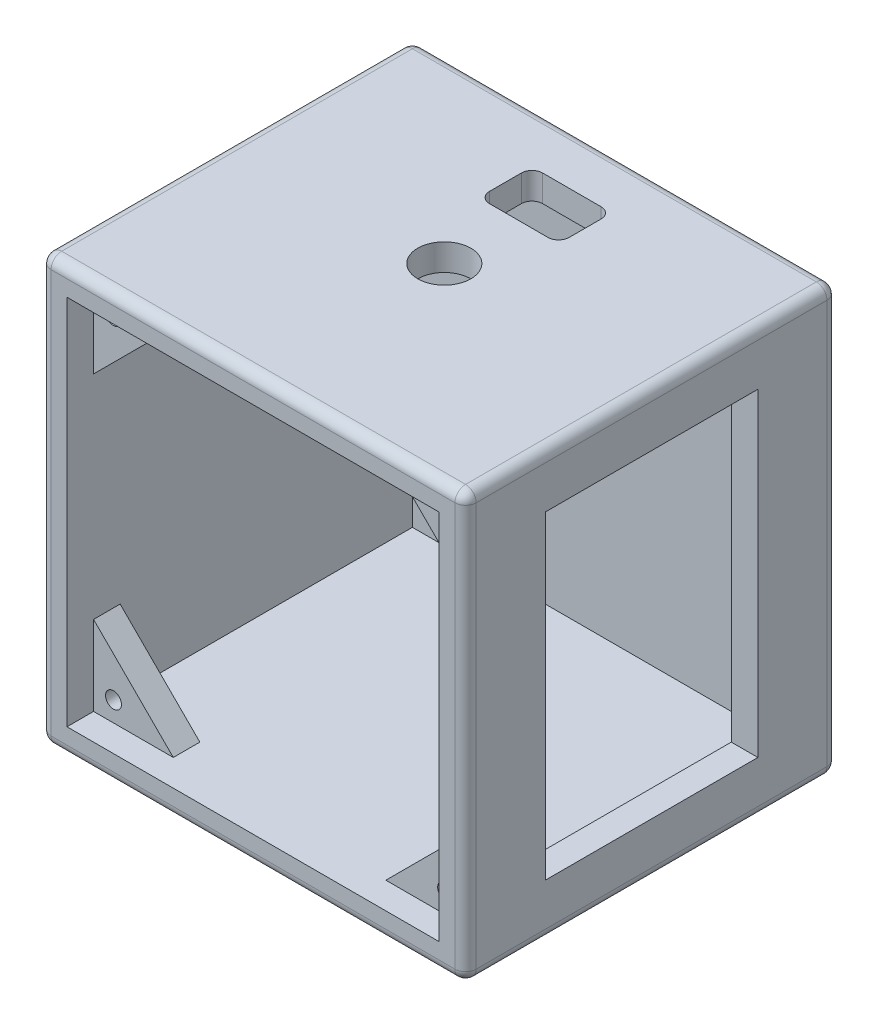
from build123d import *

# Parameters (mm, degrees)
SKETCH_1_W          = 80
SKETCH_1_H          = 80
EXTRUDE_1_DEPTH     = 70
SKETCH_2_W          = 70
SKETCH_2_H          = 70
CUT_EXTRUDE_1_DEPTH = 65
FILLET_1_R          = 2
FILLET_2_R          = 2
FILLET_3_R          = 2
CUT_EXTRUDE_3_DEPTH = 10
SKETCH_4_W          = 10
SKETCH_4_H          = 30
CUT_EXTRUDE_4_DEPTH = 10
SKETCH_5_R          = 5
CUT_EXTRUDE_5_DEPTH = 10
FILLET_4_R          = 2
SKETCH_6_W          = 40
SKETCH_6_H          = 60
CUT_EXTRUDE_6_DEPTH = 10
SKETCH_7_R          = 1.5
EXTRUDE_2_DEPTH     = 60
SKETCH_8_W          = 70
SKETCH_8_H          = 70
CUT_EXTRUDE_7_DEPTH = 60
SKETCH_9_W          = 70
SKETCH_9_H          = 70
EXTRUDE_3_DEPTH     = 5


with BuildPart() as part:
    # Эскиз1 → Бобышка-Вытянуть1 (new body)
    with BuildSketch(Plane.XY):
        Rectangle(SKETCH_1_W, SKETCH_1_H)
    extrude(amount=EXTRUDE_1_DEPTH)

    # Эскиз2 → Вырез-Вытянуть1 (cut)
    with BuildSketch(Plane.XY.offset(70)):
        Rectangle(SKETCH_2_W, SKETCH_2_H)
    extrude(amount=-CUT_EXTRUDE_1_DEPTH, mode=Mode.SUBTRACT)

    # Скругление1
    fillet_1_edges = [part.edges().sort_by_distance(p)[0] for p in [
        (-40, 40, 35),
        (-40, -40, 35),
    ]]
    fillet(fillet_1_edges, radius=FILLET_1_R)

    # Скругление2
    fillet_2_edges = [part.edges().sort_by_distance(p)[0] for p in [
        (1, -40, 0),
        (-40, 0, 0),
        (-39.414213562, 39.414213562, 0),
        (-39.414213562, -39.414213562, 0),
        (1, 40, 0),
        (40, 0, 0),
        (40, 40, 35),
    ]]
    fillet(fillet_2_edges, radius=FILLET_2_R)

    # Скругление3
    # the kernel refuses this fillet: 2 mm, written as the material it takes off along each edge
    with BuildSketch(Plane(origin=(38, -38, 2), x_dir=(1, 0, 0), z_dir=(0, -1, 0))) as fillet_3_piece_1_section:
        Polygon((0, 0), (FILLET_3_R, 0), (FILLET_3_R, -FILLET_3_R), (0, -FILLET_3_R), align=None)
    fillet_3_piece_1 = extrude(amount=FILLET_3_R, mode=Mode.PRIVATE)
    fillet_3_piece_1 = fillet_3_piece_1 - Plane(origin=(38, -38, 2), x_dir=(-0.7071067811865475, 0, 0.7071067811865475), z_dir=(0, -1, 0)) * Sphere(FILLET_3_R, mode=Mode.PRIVATE)
    add(fillet_3_piece_1, mode=Mode.SUBTRACT)
    with BuildSketch(Plane(origin=(40, -40, 2), x_dir=(-1, 0, 0), z_dir=(0, 0, 1))) as fillet_3_piece_2:
        with BuildLine():
            CenterArc((FILLET_3_R, -FILLET_3_R), FILLET_3_R, 90, 90)
            Line((0, -FILLET_3_R), (0, 0))
            Line((0, 0), (FILLET_3_R, 0))
        make_face()
    extrude(amount=73, mode=Mode.SUBTRACT)

    # Эскиз3 → Вырез-Вытянуть3 (cut)
    with BuildSketch(Plane(origin=(0, 40, 0), x_dir=(1, 0, 0), z_dir=(0, 1, 0))):
        with BuildLine():
            Line((5.5, -20), (-5.5, -20))
            ThreePointArc((-5.5, -20), (-6.914213562, -19.414213562), (-7.5, -18))
            Line((-7.5, -18), (-7.5, -12))
            ThreePointArc((-7.5, -12), (-6.914213562, -10.585786438), (-5.5, -10))
            Line((-5.5, -10), (5.5, -10))
            ThreePointArc((5.5, -10), (6.914213562, -10.585786438), (7.5, -12))
            Line((7.5, -12), (7.5, -18))
            ThreePointArc((7.5, -18), (6.914213562, -19.414213562), (5.5, -20))
        make_face()
    extrude(amount=-CUT_EXTRUDE_3_DEPTH, mode=Mode.SUBTRACT)

    # Эскиз4 → Вырез-Вытянуть4 (cut)
    with BuildSketch(Plane(origin=(40, 0, 0), x_dir=(0, 0, -1), z_dir=(1, 0, 0))):
        with Locations((-36, 0)):
            Rectangle(SKETCH_4_W, SKETCH_4_H)
    extrude(amount=-CUT_EXTRUDE_4_DEPTH, mode=Mode.SUBTRACT)

    # Эскиз5 → Вырез-Вытянуть5 (cut)
    with BuildSketch(Plane(origin=(0, 40, 0), x_dir=(1, 0, 0), z_dir=(0, 1, 0))):
        with Locations(Location((0, -34, 0), (0, 0, 270))):
            Circle(SKETCH_5_R)
    extrude(amount=-CUT_EXTRUDE_5_DEPTH, mode=Mode.SUBTRACT)

    # Скругление4
    fillet_4_edges = [part.edges().sort_by_distance(p)[0] for p in [
        (0, -40, 70),
        (-40, 0, 70),
        (-39.414213562, 39.414213562, 70),
        (-39.414213562, -39.414213562, 70),
        (0, 40, 70),
        (39.414213562, 39.414213562, 70),
        (40, 0, 70),
        (39.414213562, -39.414213562, 70),
    ]]
    fillet(fillet_4_edges, radius=FILLET_4_R)

    # Эскиз6 → Вырез-Вытянуть6 (cut)
    with BuildSketch(Plane(origin=(40, 0, 0), x_dir=(0, 0, -1), z_dir=(1, 0, 0))):
        with Locations((-35, 0)):
            Rectangle(SKETCH_6_W, SKETCH_6_H)
    extrude(amount=-CUT_EXTRUDE_6_DEPTH, mode=Mode.SUBTRACT)

    # Эскиз7 → Бобышка-Вытянуть2 (add)
    # profile 1 of 4: a face of its own
    with BuildSketch(Plane.XY.offset(5)):
        Polygon((-20, 35), (-35, 20), (-35, 35), align=None)
        with Locations((-31.25, 31.25)):
            Circle(SKETCH_7_R, mode=Mode.SUBTRACT)
    # profile 2 of 4: a face of its own
    with BuildSketch(Plane.XY.offset(5)):
        Polygon((35, 20), (20, 35), (35, 35), align=None)
        with Locations((31.25, 31.25)):
            Circle(SKETCH_7_R, mode=Mode.SUBTRACT)
    # profile 3 of 4: a face of its own
    with BuildSketch(Plane.XY.offset(5)):
        Polygon((20, -35), (35, -20), (35, -35), align=None)
        with Locations((31.25, -31.25)):
            Circle(SKETCH_7_R, mode=Mode.SUBTRACT)
    # profile 4 of 4: a face of its own
    with BuildSketch(Plane.XY.offset(5)):
        Polygon((-35, -20), (-20, -35), (-35, -35), align=None)
        with Locations((-31.25, -31.25)):
            Circle(SKETCH_7_R, mode=Mode.SUBTRACT)
    extrude(amount=EXTRUDE_2_DEPTH)

    # Эскиз8 → Вырез-Вытянуть7 (cut)
    with BuildSketch(Plane(origin=(0, 0, 0), x_dir=(-1, 0, 0), z_dir=(0, 0, -1))):
        Rectangle(SKETCH_8_W, SKETCH_8_H)
    extrude(amount=-CUT_EXTRUDE_7_DEPTH, mode=Mode.SUBTRACT)


with BuildPart() as body_2:
    # Эскиз9 → Бобышка-Вытянуть3 (new body)
    with BuildSketch(Plane(origin=(0, 0, 0), x_dir=(-1, 0, 0), z_dir=(0, 0, -1))):
        Rectangle(SKETCH_9_W, SKETCH_9_H)
    extrude(amount=-EXTRUDE_3_DEPTH)


solid = Compound([part.part, body_2.part])
